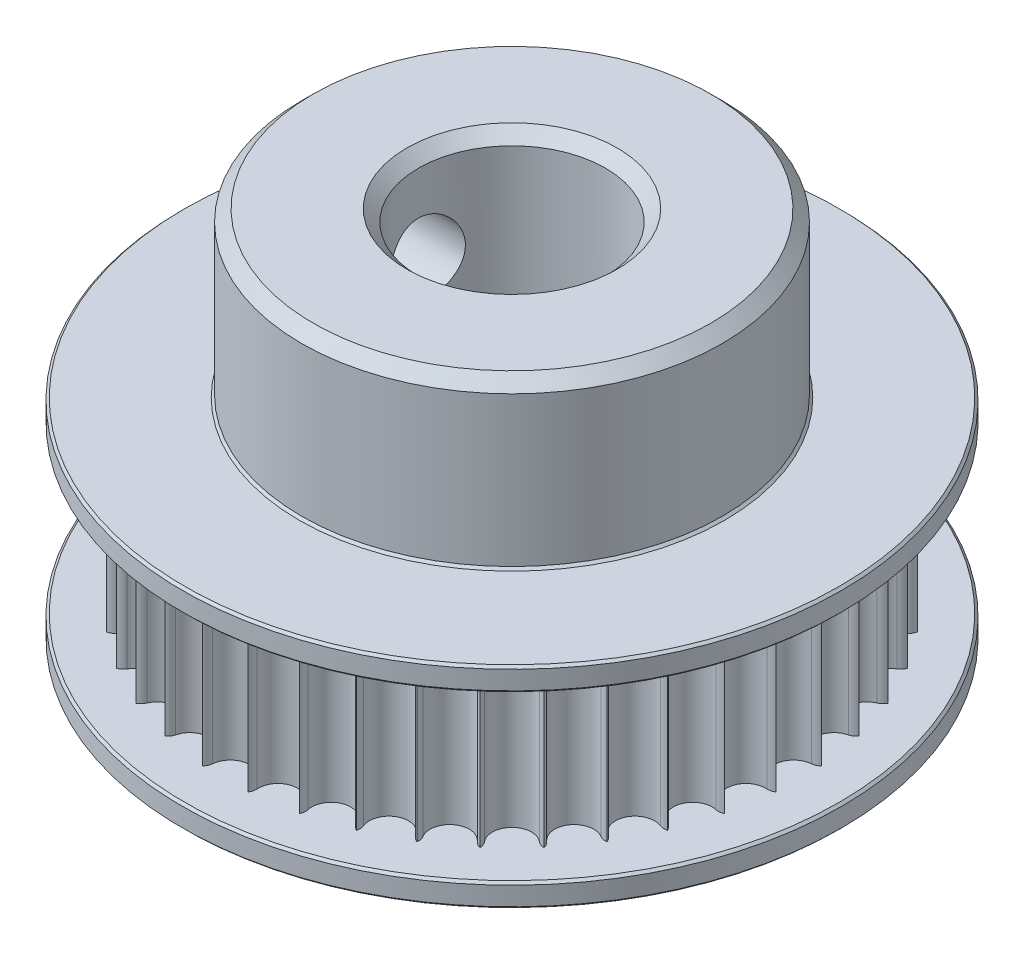
from build123d import *

# Parameters (mm, degrees)
CUT_EXTRUDE3_DEPTH      = 7
CIRPATTERN1_COUNT       = 40
CUT_EXTRUDE2_REACH      = 23.676
CUT_EXTRUDE2_END_RADIUS = 9
SKETCH3_R               = 1.65
CHAMFER1_SIZE           = 1
CHAMFER2_SIZE           = 0.5
CHAMFER3_SIZE           = 0.1


with BuildPart() as part:
    # Skica2 → Revolute (revolve)
    with BuildSketch(Plane.XY):
        Polygon((9, 8.5), (4, 8.5), (4, -8.5), (6.11, -8.5), (6.11, -7.5), (14.1, -7.5), (14.1, -6.5), (12.5, -6.5), (12.5, 0.5), (14.1, 0.5), (14.1, 1.5), (9, 1.5), align=None)
    revolve(axis=Axis((0, -8.5, 0), (0, 1, 0)))

    # Sketch2 → Cut-Extrude3 (cut)
    with BuildSketch(Plane.XZ.offset(-0.5)):
        with BuildLine():
            ThreePointArc((-0.832572418, 11.97108279), (0, 11.210469025), (0.832572418, 11.97108279))
            ThreePointArc((0.832572418, 11.97108279), (1.014312712, 12.313309772), (1.385975582, 12.422925247))
            ThreePointArc((1.385975582, 12.422925247), (1.771675151, 12.373809727), (2.155660572, 12.312722181))
            ThreePointArc((2.155660572, 12.312722181), (1.541189214, 13.740623371), (0, 13.943632401))
            ThreePointArc((0, 13.943632401), (-1.541189214, 13.740623371), (-2.155660572, 12.312722181))
            ThreePointArc((-2.155660572, 12.312722181), (-1.771675151, 12.373809727), (-1.385975582, 12.422925247))
            ThreePointArc((-1.385975582, 12.422925247), (-1.014312712, 12.313309772), (-0.832572418, 11.97108279))
        make_face()
    cut_extrude3 = extrude(amount=CUT_EXTRUDE3_DEPTH, mode=Mode.SUBTRACT)

    # CirPattern1: Cut-Extrude3 ×40 about axis
    cirpattern1_axis = Axis((0, 0, 0), (0, 1, 0))
    for i in range(1, CIRPATTERN1_COUNT):
        add(cut_extrude3.rotate(cirpattern1_axis, i * 360 / CIRPATTERN1_COUNT), mode=Mode.SUBTRACT)

    # Cut-Extrude2: up to this cylinder (the profile starts inside it)
    cut_extrude2_end = Plane(origin=(0, 4.5, 0), z_dir=(0, -1, 0)) * Cylinder(CUT_EXTRUDE2_END_RADIUS, 66.352, mode=Mode.PRIVATE)
    # Sketch3 → Cut-Extrude2 (cut, up to the surface)
    with BuildSketch(Plane(origin=(0, 0, 0), x_dir=(0, 0, -1), z_dir=(1, 0, 0)), mode=Mode.PRIVATE) as cut_extrude2_sk1:
        with Locations((0, 4.5)):
            Circle(SKETCH3_R)
    cut_extrude2_tool1 = extrude(cut_extrude2_sk1.sketch, amount=-CUT_EXTRUDE2_REACH, mode=Mode.PRIVATE) & cut_extrude2_end
    add(cut_extrude2_tool1.solids().sort_by_distance((0, 4.5, 0))[0], mode=Mode.SUBTRACT)

    # Chamfer1
    chamfer1_edges = [part.edges().sort_by_distance(p)[0] for p in [
        (-6.11, -7.5, 0),
    ]]
    chamfer(chamfer1_edges, length=CHAMFER1_SIZE - 0.0001)  # a hair under: the kernel refuses the full size

    # Chamfer2
    chamfer2_edges = [part.edges().sort_by_distance(p)[0] for p in [
        (-4, 8.5, 0),
        (-9, 8.5, 0),
    ]]
    chamfer(chamfer2_edges, length=CHAMFER2_SIZE)

    # Chamfer3
    chamfer3_edges = [part.edges().sort_by_distance(p)[0] for p in [
        (-14.1, 0.5, 0),
        (-14.1, -6.5, 0),
        (-14.1, -7.5, 0),
        (-9, 1.5, 0),
        (-14.1, 1.5, 0),
    ]]
    chamfer(chamfer3_edges, length=CHAMFER3_SIZE)


solid = part.part
